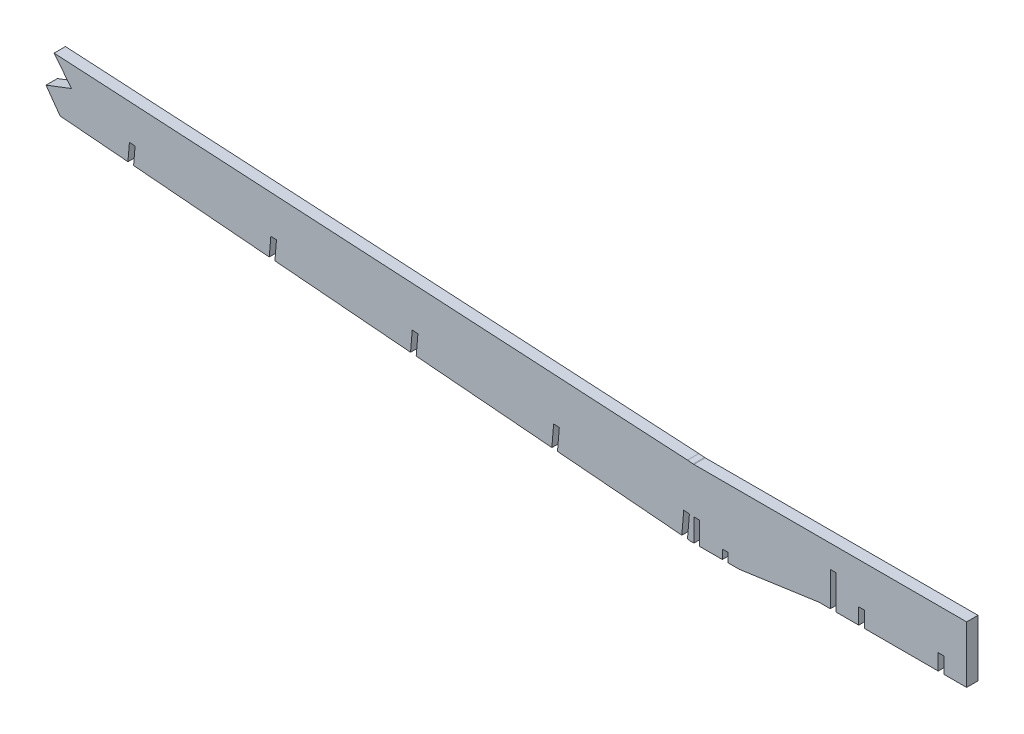
from build123d import *

# Parameters (mm, degrees)
BOSS_EXTRUDE1_DEPTH = 3.175
CUT_EXTRUDE1_DEPTH  = 955.556499367
CUT_EXTRUDE2_DEPTH  = 7.62


with BuildPart() as part:
    # Sketch1 → Boss-Extrude1 (new, symmetric)
    with BuildSketch(Plane.XY):
        Polygon((76.2, 37.697541537), (76.2, 56.747541537), (79.375, 56.747541537), (79.375, 37.697541537), (92.075, 37.697541537), (92.075, 46.587541537), (95.25, 46.587541537), (95.25, 37.697541537), (136.525, 37.697541537), (136.525, 46.587541537), (139.7, 46.587541537), (139.7, 37.697541537), (152.4, 37.697541537), (152.4, 69.447541537), (0, 69.447541537), (-0.423998633, 69.491926731), (-3.587863461, 69.757603883), (-946.051908629, 122.953392794), (-946.583462345, 116.623288424), (-943.412318182, 116.444298555), (-943.91275138, 110.48479854), (-6.775989292, 31.791225946), (-5.713280681, 44.446685258), (-2.549415853, 44.181008106), (-3.612124464, 31.525548794), (-1.492292584, 31.347541537), (0, 31.347541537), (0, 44.047541537), (3.175, 44.047541537), (3.175, 31.347541537), (15.875, 31.347541537), (15.875, 36.427541537), (19.05, 36.427541537), (19.05, 31.347541537), (25.4, 31.347541537), (69.85, 37.697541537), align=None)
    extrude(amount=BOSS_EXTRUDE1_DEPTH, both=True)

    # Sketch2 → Cut-Extrude1 (cut, through all)
    with BuildSketch(Plane.XY.offset(3.175)):
        Polygon((-76.254460917, 37.625496217), (-75.245037036, 49.646404609), (-78.411328309, 49.883186), (-79.418325745, 37.891173369), align=None)
        Polygon((-155.224527027, 44.256797945), (-154.27566721, 55.556468134), (-157.441958483, 55.793249525), (-158.388391855, 44.522475098), align=None)
        Polygon((-234.194593137, 50.888099674), (-233.306297384, 61.466531659), (-236.472588657, 61.70331305), (-237.358457965, 51.153776826), align=None)
        Polygon((-313.164659247, 57.519401402), (-312.336927558, 67.376595183), (-315.503218831, 67.613376574), (-316.328524075, 57.785078555), align=None)
        Polygon((-392.134725356, 64.15070313), (-391.367557732, 73.286658708), (-394.533849005, 73.523440099), (-395.298590185, 64.416380283), align=None)
        Polygon((-471.104791466, 70.782004859), (-470.398187906, 79.196722233), (-473.564479179, 79.433503624), (-474.268656294, 71.047682011), align=None)
        Polygon((-550.074857576, 77.413306587), (-549.42881808, 85.106785757), (-552.595109353, 85.343567149), (-553.238722404, 77.67898374), align=None)
        Polygon((-629.044923686, 84.044608316), (-628.459448254, 91.016849282), (-631.625739527, 91.253630673), (-632.208788514, 84.310285468), align=None)
        Polygon((-708.014989796, 90.675910044), (-707.490078428, 96.926912807), (-710.656369701, 97.163694198), (-711.178854624, 90.941587197), align=None)
        Polygon((-786.985055905, 97.307211772), (-786.520708602, 102.836976331), (-789.686999875, 103.073757723), (-790.148920734, 97.572888925), align=None)
        Polygon((-865.955122015, 103.938513501), (-865.551338776, 108.747039856), (-868.717630049, 108.983821247), (-869.118986843, 104.204190653), align=None)
    extrude(amount=-CUT_EXTRUDE1_DEPTH, mode=Mode.SUBTRACT)

    # Sketch3 → Cut-Extrude2 (cut)
    with BuildSketch(Plane.XY.offset(3.175)):
        Polygon((-354.231624716, 60.967890842), (-362.126685184, 71.979397876), (-347.872352174, 77.449083798), (-357.599036746, 89.739165772), (-993.791218606, 254.183288708), (-993.791218606, 28.735079887), align=None)
    extrude(amount=-CUT_EXTRUDE2_DEPTH, mode=Mode.SUBTRACT)


solid = part.part
